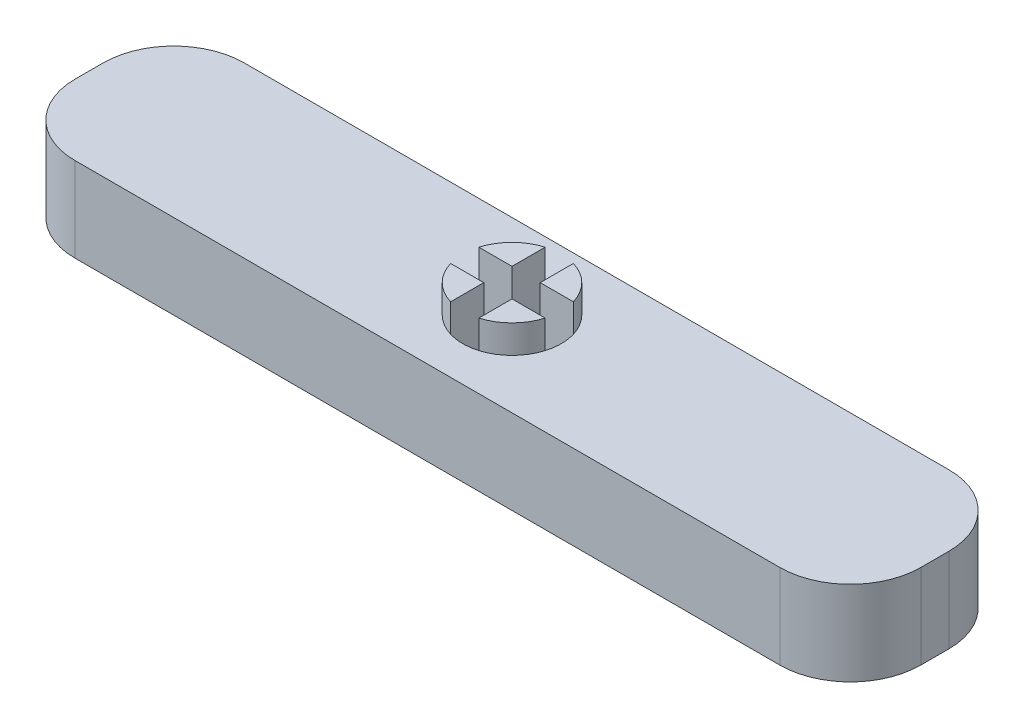
from build123d import *

# Parameters (mm, degrees)
BOSS_EXTRUDE1_DEPTH = 6
SKETCH2_R           = 3.5
BOSS_EXTRUDE2_DEPTH = 2
CUT_EXTRUDE1_START  = -5
CUT_EXTRUDE1_DEPTH  = 5


with BuildPart() as part:
    # Sketch1 → Boss-Extrude1 (new body)
    with BuildSketch(Plane(origin=(0, 0, 0), x_dir=(1, 0, 0), z_dir=(0, 1, 0))):
        with BuildLine():
            Line((-25, -6), (25, -6))
            ThreePointArc((25, -6), (28.535533906, -4.535533906), (30, -1))
            Line((30, -1), (30, 1))
            ThreePointArc((30, 1), (28.535533906, 4.535533906), (25, 6))
            Line((25, 6), (-25, 6))
            ThreePointArc((-25, 6), (-28.535533906, 4.535533906), (-30, 1))
            Line((-30, 1), (-30, -1))
            ThreePointArc((-30, -1), (-28.535533906, -4.535533906), (-25, -6))
        make_face()
    extrude(amount=BOSS_EXTRUDE1_DEPTH)

    # Sketch2 → Boss-Extrude2 (add)
    with BuildSketch(Plane(origin=(0, 6, 0), x_dir=(1, 0, 0), z_dir=(0, 1, 0))):
        Circle(SKETCH2_R)
    extrude(amount=BOSS_EXTRUDE2_DEPTH)

    # Sketch3 → Cut-Extrude1 (cut)
    with BuildSketch(Plane(origin=(0, 8, 0), x_dir=(1, 0, 0), z_dir=(0, 1, 0)).offset(CUT_EXTRUDE1_START)):
        with BuildLine():
            Line((1, 1), (1, 2.711886906))
            Line((1, 2.711886906), (1, 3.354101966))
            ThreePointArc((1, 3.354101966), (0, 3.5), (-1, 3.354101966))
            Line((-1, 3.354101966), (-1, 2.711886906))
            Line((-1, 2.711886906), (-1, 1))
            Line((-1, 1), (-3.354101966, 1))
            ThreePointArc((-3.354101966, 1), (-3.5, 0), (-3.354101966, -1))
            Line((-3.354101966, -1), (-1, -1))
            Line((-1, -1), (-1, -3.354101966))
            ThreePointArc((-1, -3.354101966), (0, -3.5), (1, -3.354101966))
            Line((1, -3.354101966), (1, -1))
            Line((1, -1), (2.900401276, -1))
            Line((2.900401276, -1), (3.354101966, -1))
            ThreePointArc((3.354101966, -1), (3.463333429, -0.505293538), (3.5, 0))
            ThreePointArc((3.5, 0), (3.463333429, 0.505293538), (3.354101966, 1))
            Line((3.354101966, 1), (2.900401276, 1))
            Line((2.900401276, 1), (1, 1))
        make_face()
    extrude(amount=CUT_EXTRUDE1_DEPTH, mode=Mode.SUBTRACT)


solid = part.part
